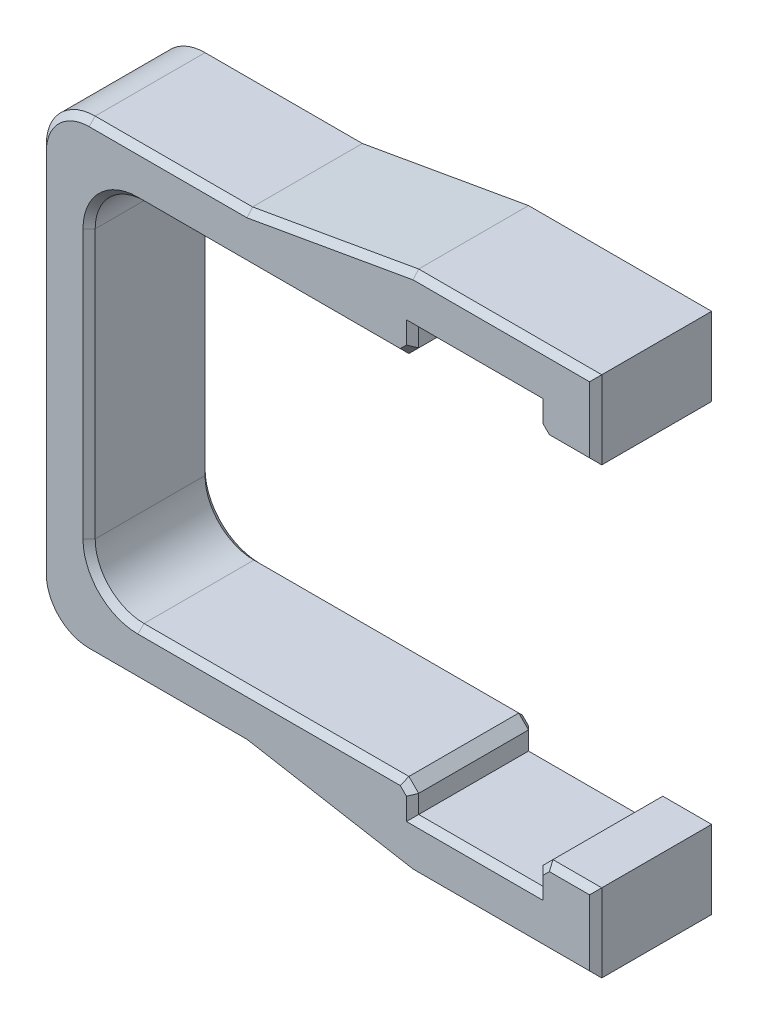
from build123d import *
from OCP.BRepFilletAPI import BRepFilletAPI_MakeChamfer

# Parameters (mm, degrees)
BOSS_EXTRUDE1_DEPTH = 10
FILLET1_R           = 4
SKETCH3_W           = 10
SKETCH3_H           = 6.4
BOSS_EXTRUDE2_DEPTH = 15
SKETCH5_W           = 10.2
SKETCH5_H           = 34.6
CUT_EXTRUDE1_DEPTH  = 15
CHAMFER2_SIZE       = 13.611076367
CHAMFER2_SIZE_2     = 2.4
CHAMFER3_SIZE       = 0.8
CHAMFER1_SIZE       = 0.5


# Some blends are built 0.0001 mm under size
with BuildPart() as part:
    # Sketch1 → Boss-Extrude1 (new body)
    with BuildSketch(Plane.XY):
        Polygon((0, 0), (0, 38), (30.5, 38), (30.5, 34), (4, 34), (4, 4), (30.5, 4), (30.5, 0), align=None)
    extrude(amount=BOSS_EXTRUDE1_DEPTH)

    # Fillet1
    fillet1_edges = [part.edges().sort_by_distance(p)[0] for p in [
        (0, 0, 5),
        (0, 38, 5),
        (4, 34, 5),
        (4, 4, 5),
    ]]
    fillet(fillet1_edges, radius=FILLET1_R)

    # Sketch3 → Boss-Extrude2 (add)
    with BuildSketch(Plane(origin=(30.5, 0, 0), x_dir=(0, 0, -1), z_dir=(1, 0, 0))):
        with Locations((-5, 37.2)):
            Rectangle(SKETCH3_W, SKETCH3_H)
        with Locations((-5, 0.8)):
            Rectangle(SKETCH3_W, SKETCH3_H)
    extrude(amount=BOSS_EXTRUDE2_DEPTH)

    # Sketch5 → Cut-Extrude1 (cut)
    with BuildSketch(Plane.XY.offset(10)):
        with Locations((35.6, 19)):
            Rectangle(SKETCH5_W, SKETCH5_H)
    extrude(amount=-CUT_EXTRUDE1_DEPTH, mode=Mode.SUBTRACT)

    # Chamfer2
    chamfer2_edges_1 = [part.edges().sort_by_distance(p)[0] for p in [
        (30.5, 0, 5),
    ]]
    chamfer2_side_1 = [part.faces().sort_by_distance(p)[0] for p in [
        (30.452, 0, 5),
    ]]
    chamfer2_edges_2 = [part.edges().sort_by_distance(p)[0] for p in [
        (30.5, 38, 5),
    ]]
    chamfer2_side_2 = [part.faces().sort_by_distance(p)[0] for p in [
        (30.5, 38.048, 5),
    ]]
    chamfer2 = BRepFilletAPI_MakeChamfer(part.part.solid().wrapped)
    for e in chamfer2_edges_1:
        chamfer2.Add(CHAMFER2_SIZE - 0.0001, CHAMFER2_SIZE_2 - 0.0001, e.wrapped, chamfer2_side_1[0].wrapped)
    for e in chamfer2_edges_2:
        chamfer2.Add(CHAMFER2_SIZE_2 - 0.0001, CHAMFER2_SIZE - 0.0001, e.wrapped, chamfer2_side_2[0].wrapped)
    add(Compound.cast(chamfer2.Shape()), mode=Mode.REPLACE)  # a hair under: the kernel refuses the full size

    # Chamfer3
    chamfer3_edges = [part.edges().sort_by_distance(p)[0] for p in [
        (30.5, 4, 5),
        (30.5, 34, 5),
        (40.7, 34, 5),
        (40.7, 4, 5),
    ]]
    chamfer(chamfer3_edges, length=CHAMFER3_SIZE)

    # Chamfer1
    # the kernel refuses this chamfer: 0.5 mm, written as the material it takes off along each edge
    with BuildSketch(Plane(origin=(46.785841494, 4, 10), x_dir=(0, 0, -1), z_dir=(-1, 0, 0)), Plane(origin=(40.214158506, 34, 10), x_dir=(0, 0, -1), z_dir=(1, 0, 0))) as chamfer1_piece_1:
        Polygon((CHAMFER1_SIZE, 0), (0, CHAMFER1_SIZE), (0, 0), align=None)
    extrude(amount=6.571682988, mode=Mode.SUBTRACT)
    with BuildSketch(Plane(origin=(4, 38, 0), x_dir=(0, -1, 0), z_dir=(1, 0, 0))) as chamfer1_piece_2_section:
        Polygon((CHAMFER1_SIZE, 0), (0, -CHAMFER1_SIZE), (0, 0), align=None)
    chamfer1_piece_2 = extrude(amount=14.174865127, mode=Mode.PRIVATE)
    chamfer1_piece_2 = split(chamfer1_piece_2, bisect_by=Plane(origin=(4.237723472, 36.651756922, 1.369040484), z_dir=(-0.1227837169605106, 0.6963649609575091, -0.7071067811865536)), keep=Keep.TOP, mode=Mode.PRIVATE)
    add(chamfer1_piece_2, mode=Mode.SUBTRACT)
    with BuildSketch(Plane(origin=(4, 38, 10), x_dir=(0, 0, -1), z_dir=(1, 0, 0))) as chamfer1_piece_3_section:
        Polygon((CHAMFER1_SIZE, 0), (0, -CHAMFER1_SIZE), (0, 0), align=None)
    chamfer1_piece_3 = extrude(amount=14.174865127, mode=Mode.PRIVATE)
    chamfer1_piece_3 = split(chamfer1_piece_3, bisect_by=Plane(origin=(4.237723472, 36.651756922, 8.630959516), z_dir=(-0.1227837169605106, 0.6963649609575091, 0.7071067811865536)), keep=Keep.TOP, mode=Mode.PRIVATE)
    add(chamfer1_piece_3, mode=Mode.SUBTRACT)
    with BuildSketch(Plane(origin=(15.62271565, 0.2232766, 0), x_dir=(0.17364239776413462, 0.9848087721475283, 0), z_dir=(0.9848087721475283, -0.17364239776413462, 0))) as chamfer1_piece_4_section:
        Polygon((CHAMFER1_SIZE, 0), (0, CHAMFER1_SIZE), (0, 0), align=None)
    chamfer1_piece_4 = extrude(amount=16.392616302, mode=Mode.PRIVATE)
    chamfer1_piece_4 = split(chamfer1_piece_4, bisect_by=Plane(origin=(15.62271565, 0.3616383, 0.1383617), z_dir=(0, -0.7071067811865471, -0.7071067811865479)), keep=Keep.TOP, mode=Mode.PRIVATE)
    add(chamfer1_piece_4, mode=Mode.SUBTRACT)
    with BuildSketch(Plane(origin=(15.62271565, 0.2232766, 10), x_dir=(0, 0, -1), z_dir=(0.9848087721475283, -0.17364239776413462, 0))) as chamfer1_piece_5_section:
        Polygon((CHAMFER1_SIZE, 0), (0, CHAMFER1_SIZE), (0, 0), align=None)
    chamfer1_piece_5 = extrude(amount=16.392616302, mode=Mode.PRIVATE)
    chamfer1_piece_5 = split(chamfer1_piece_5, bisect_by=Plane(origin=(15.62271565, 0.3616383, 9.8616383), z_dir=(0, -0.7071067811865471, 0.7071067811865479)), keep=Keep.TOP, mode=Mode.PRIVATE)
    add(chamfer1_piece_5, mode=Mode.SUBTRACT)
    with BuildSketch(Plane(origin=(31.766307983, 40.6231766, 0), x_dir=(0.17364239776413495, -0.9848087721475282, 0), z_dir=(-0.9848087721475282, -0.17364239776413493, 0))) as chamfer1_piece_6_section:
        Polygon((CHAMFER1_SIZE, 0), (0, CHAMFER1_SIZE), (0, 0), align=None)
    chamfer1_piece_6 = extrude(amount=16.392616302, mode=Mode.PRIVATE)
    chamfer1_piece_6 = split(chamfer1_piece_6, bisect_by=Plane(origin=(31.766307983, 39.0615883, 1.5615883), z_dir=(0, 0.7071067811865476, -0.7071067811865476)), keep=Keep.TOP, mode=Mode.PRIVATE)
    add(chamfer1_piece_6, mode=Mode.SUBTRACT)
    with BuildSketch(Plane(origin=(31.766307983, 40.6231766, 10), x_dir=(0, 0, -1), z_dir=(-0.9848087721475282, -0.17364239776413493, 0))) as chamfer1_piece_7_section:
        Polygon((CHAMFER1_SIZE, 0), (0, CHAMFER1_SIZE), (0, 0), align=None)
    chamfer1_piece_7 = extrude(amount=16.392616302, mode=Mode.PRIVATE)
    chamfer1_piece_7 = split(chamfer1_piece_7, bisect_by=Plane(origin=(31.766307983, 39.0615883, 8.4384117), z_dir=(0, 0.7071067811865476, 0.7071067811865476)), keep=Keep.TOP, mode=Mode.PRIVATE)
    add(chamfer1_piece_7, mode=Mode.SUBTRACT)
    with BuildSketch(Plane(origin=(40.7, 37.585841494, 10), x_dir=(0, 0, -1), z_dir=(0, -1, 0))) as chamfer1_piece_8_section:
        Polygon((CHAMFER1_SIZE, 0), (0, CHAMFER1_SIZE), (0, 0), align=None)
    chamfer1_piece_8 = extrude(amount=4.071682988, mode=Mode.PRIVATE)
    chamfer1_piece_8 = split(chamfer1_piece_8, bisect_by=Plane(origin=(40.7, 37.192920747, 10.392920747), z_dir=(0, -0.7071067811865476, 0.7071067811865476)), keep=Keep.TOP, mode=Mode.PRIVATE)
    add(chamfer1_piece_8, mode=Mode.SUBTRACT)
    with BuildSketch(Plane(origin=(30.5, 0.414158506, 10), x_dir=(0, 0, -1), z_dir=(0, 1, 0))) as chamfer1_piece_9_section:
        Polygon((CHAMFER1_SIZE, 0), (0, CHAMFER1_SIZE), (0, 0), align=None)
    chamfer1_piece_9 = extrude(amount=4.071682988, mode=Mode.PRIVATE)
    chamfer1_piece_9 = split(chamfer1_piece_9, bisect_by=Plane(origin=(30.5, 0.807079253, 10.392920747), z_dir=(0, 0.7071067811865476, 0.7071067811865476)), keep=Keep.TOP, mode=Mode.PRIVATE)
    add(chamfer1_piece_9, mode=Mode.SUBTRACT)
    with BuildSketch(Plane(origin=(30.985841494, 4, 10), x_dir=(0, 0, -1), z_dir=(-1, 0, 0)), Plane(origin=(8, 34, 10), x_dir=(0, 0, -1), z_dir=(1, 0, 0))) as chamfer1_piece_10:
        Polygon((CHAMFER1_SIZE, 0), (0, CHAMFER1_SIZE), (0, 0), align=None)
    extrude(amount=22.985841494, mode=Mode.SUBTRACT)
    with BuildSketch(Plane(origin=(31.40922724, 35.70922724, 10), x_dir=(0, 0, -1), z_dir=(-0.7071067811865491, -0.707106781186546, 0)), Plane(origin=(42.40922724, 33.09077276, 10), x_dir=(0, 0, -1), z_dir=(-0.7071067811865476, 0.7071067811865476, 0)), Plane(origin=(31.40922724, 35.70922724, 0), x_dir=(-0.7071067811865459, 0.707106781186549, 0), z_dir=(-0.7071067811865491, -0.707106781186546, 0)), Plane(origin=(42.40922724, 33.09077276, 0), x_dir=(0.7071067811865476, 0.7071067811865476, 1.7763568394002363e-15), z_dir=(-0.7071067811865476, 0.7071067811865476, 0))) as chamfer1_piece_11:
        Polygon((CHAMFER1_SIZE, 0), (0, -CHAMFER1_SIZE), (0, 0), align=None)
    extrude(amount=3.703053838, mode=Mode.SUBTRACT)
    with BuildSketch(Plane(origin=(31.40922724, 2.29077276, 10), x_dir=(0, 0, -1), z_dir=(-0.7071067811865479, 0.7071067811865471, 0)), Plane(origin=(42.40922724, 4.90922724, 10), x_dir=(0, 0, -1), z_dir=(-0.7071067811865464, -0.7071067811865487, 0)), Plane(origin=(31.40922724, 2.29077276, 0), x_dir=(-0.7071067811865472, -0.7071067811865479, 0), z_dir=(-0.7071067811865479, 0.7071067811865471, 0)), Plane(origin=(42.40922724, 4.90922724, 0), x_dir=(0.7071067811865486, -0.7071067811865464, 0), z_dir=(-0.7071067811865464, -0.7071067811865487, 0))) as chamfer1_piece_12:
        Polygon((CHAMFER1_SIZE, 0), (0, CHAMFER1_SIZE), (0, 0), align=None)
    extrude(amount=3.703053838, mode=Mode.SUBTRACT)
    with BuildSketch(Plane(origin=(40.7, 0.414158506, 0), x_dir=(1, 0, 0), z_dir=(0, 1, 0))) as chamfer1_piece_13_section:
        Polygon((CHAMFER1_SIZE, 0), (0, -CHAMFER1_SIZE), (0, 0), align=None)
    chamfer1_piece_13 = extrude(amount=4.071682988, mode=Mode.PRIVATE)
    chamfer1_piece_13 = split(chamfer1_piece_13, bisect_by=Plane(origin=(40.7, 0.807079253, -0.392920747), z_dir=(0, 0.7071067811865476, -0.7071067811865476)), keep=Keep.TOP, mode=Mode.PRIVATE)
    add(chamfer1_piece_13, mode=Mode.SUBTRACT)
    with BuildSketch(Plane(origin=(30.5, 37.585841494, 0), x_dir=(-1, 0, 0), z_dir=(0, -1, 0))) as chamfer1_piece_14_section:
        Polygon((CHAMFER1_SIZE, 0), (0, -CHAMFER1_SIZE), (0, 0), align=None)
    chamfer1_piece_14 = extrude(amount=4.071682988, mode=Mode.PRIVATE)
    chamfer1_piece_14 = split(chamfer1_piece_14, bisect_by=Plane(origin=(30.5, 37.192920747, -0.392920747), z_dir=(0, -0.7071067811865476, -0.7071067811865476)), keep=Keep.TOP, mode=Mode.PRIVATE)
    add(chamfer1_piece_14, mode=Mode.SUBTRACT)
    with BuildSketch(Plane(origin=(8, 4, 0), x_dir=(0, -1, 0), z_dir=(1, 0, 0)), Plane(origin=(30.985841494, 34, 0), x_dir=(0, 1, 0), z_dir=(-1, 0, 0))) as chamfer1_piece_15:
        Polygon((CHAMFER1_SIZE, 0), (0, -CHAMFER1_SIZE), (0, 0), align=None)
    extrude(amount=22.985841494, mode=Mode.SUBTRACT)
    with BuildSketch(Plane(origin=(46.785841494, 34, 0), x_dir=(0, 1, 0), z_dir=(-1, 0, 0)), Plane(origin=(40.214158506, 4, 0), x_dir=(0, -1, 0), z_dir=(1, 0, 0))) as chamfer1_piece_16:
        Polygon((CHAMFER1_SIZE, 0), (0, -CHAMFER1_SIZE), (0, 0), align=None)
    extrude(amount=6.571682988, mode=Mode.SUBTRACT)
    with BuildSketch(Plane(origin=(4, 30, 0), x_dir=(-1, 0, 0), z_dir=(0, -1, 0)), Plane(origin=(4, 30, 10), x_dir=(0, 0, -1), z_dir=(0, -1, 0))) as chamfer1_piece_17:
        Polygon((CHAMFER1_SIZE, 0), (0, -CHAMFER1_SIZE), (0, 0), align=None)
    extrude(amount=22, mode=Mode.SUBTRACT)
    with BuildSketch(Plane(origin=(0, 4, 0), x_dir=(1, 0, 0), z_dir=(0, 1, 0)), Plane(origin=(0, 4, 10), x_dir=(0, 0, -1), z_dir=(0, 1, 0))) as chamfer1_piece_18:
        Polygon((CHAMFER1_SIZE, 0), (0, -CHAMFER1_SIZE), (0, 0), align=None)
    extrude(amount=30, mode=Mode.SUBTRACT)
    with BuildSketch(Plane(origin=(18.174865127, 0, 0), x_dir=(0, 1, 0), z_dir=(-1, 0, 0))) as chamfer1_piece_19_section:
        Polygon((CHAMFER1_SIZE, 0), (0, -CHAMFER1_SIZE), (0, 0), align=None)
    chamfer1_piece_19 = extrude(amount=14.174865127, mode=Mode.PRIVATE)
    chamfer1_piece_19 = split(chamfer1_piece_19, bisect_by=Plane(origin=(18.198890584, 0.136259816, 0.1383617), z_dir=(-0.12278371696051142, -0.6963649609575149, -0.7071067811865478)), keep=Keep.TOP, mode=Mode.PRIVATE)
    add(chamfer1_piece_19, mode=Mode.SUBTRACT)
    with BuildSketch(Plane(origin=(4, 4, 0), x_dir=(-1, 0, 0), z_dir=(0, 1, 0))) as chamfer1_piece_20:
        Polygon((4 - CHAMFER1_SIZE, 0), (4, CHAMFER1_SIZE), (4, 0), align=None)
    revolve(axis=Axis((4, 4, 0), (0, 0, 1)), revolution_arc=90, mode=Mode.SUBTRACT)
    with BuildSketch(Plane(origin=(4, 34, 0), x_dir=(-1, 0, 0), z_dir=(0, -1, 0))) as chamfer1_piece_21:
        Polygon((4 - CHAMFER1_SIZE, 0), (4, -CHAMFER1_SIZE), (4, 0), align=None)
    revolve(axis=Axis((4, 34, 0), (0, 0, -1)), revolution_arc=90, mode=Mode.SUBTRACT)
    with BuildSketch(Plane(origin=(18.174865127, 0, 10), x_dir=(0, 0, -1), z_dir=(-1, 0, 0))) as chamfer1_piece_22_section:
        Polygon((CHAMFER1_SIZE, 0), (0, -CHAMFER1_SIZE), (0, 0), align=None)
    chamfer1_piece_22 = extrude(amount=14.174865127, mode=Mode.PRIVATE)
    chamfer1_piece_22 = split(chamfer1_piece_22, bisect_by=Plane(origin=(18.198890584, 0.136259816, 9.8616383), z_dir=(-0.12278371696051138, -0.6963649609575147, 0.7071067811865477)), keep=Keep.TOP, mode=Mode.PRIVATE)
    add(chamfer1_piece_22, mode=Mode.SUBTRACT)
    with BuildSketch(Plane(origin=(4, 4, 10), x_dir=(-1, 0, 0), z_dir=(0, 1, 0))) as chamfer1_piece_23:
        Polygon((4, -CHAMFER1_SIZE), (4 - CHAMFER1_SIZE, 0), (4, 0), align=None)
    revolve(axis=Axis((4, 4, 10), (0, 0, 1)), revolution_arc=90, mode=Mode.SUBTRACT)
    with BuildSketch(Plane(origin=(4, 34, 10), x_dir=(-1, 0, 0), z_dir=(0, -1, 0))) as chamfer1_piece_24:
        Polygon((4, CHAMFER1_SIZE), (4 - CHAMFER1_SIZE, 0), (4, 0), align=None)
    revolve(axis=Axis((4, 34, 10), (0, 0, -1)), revolution_arc=90, mode=Mode.SUBTRACT)
    with BuildSketch(Plane(origin=(8, 8, 0), x_dir=(-1, 0, 0), z_dir=(0, 1, 0))) as chamfer1_piece_25:
        Polygon((4 + CHAMFER1_SIZE, 0), (4, CHAMFER1_SIZE), (4, 0), align=None)
    revolve(axis=Axis((8, 8, 0), (0, 0, 1)), revolution_arc=90, mode=Mode.SUBTRACT)
    with BuildSketch(Plane(origin=(8, 8, 10), x_dir=(-1, 0, 0), z_dir=(0, 1, 0))) as chamfer1_piece_26:
        Polygon((4, -CHAMFER1_SIZE), (4 + CHAMFER1_SIZE, 0), (4, 0), align=None)
    revolve(axis=Axis((8, 8, 10), (0, 0, 1)), revolution_arc=90, mode=Mode.SUBTRACT)
    with BuildSketch(Plane(origin=(8, 30, 0), x_dir=(0, 1, 0), z_dir=(1, 0, 0))) as chamfer1_piece_27:
        Polygon((4 + CHAMFER1_SIZE, 0), (4, CHAMFER1_SIZE), (4, 0), align=None)
    revolve(axis=Axis((8, 30, 0), (0, 0, 1)), revolution_arc=90, mode=Mode.SUBTRACT)
    with BuildSketch(Plane(origin=(8, 30, 10), x_dir=(0, 1, 0), z_dir=(1, 0, 0))) as chamfer1_piece_28:
        Polygon((4, -CHAMFER1_SIZE), (4 + CHAMFER1_SIZE, 0), (4, 0), align=None)
    revolve(axis=Axis((8, 30, 10), (0, 0, 1)), revolution_arc=90, mode=Mode.SUBTRACT)
    with BuildSketch(Plane(origin=(29.214158506, 40.4, 10), x_dir=(0, 0, -1), z_dir=(1, 0, 0)), Plane(origin=(29.214158506, 40.4, 0), x_dir=(0, -1, 0), z_dir=(1, 0, 0))) as chamfer1_piece_29:
        Polygon((CHAMFER1_SIZE, 0), (0, -CHAMFER1_SIZE), (0, 0), align=None)
    extrude(amount=17.571682988, mode=Mode.SUBTRACT)
    with BuildSketch(Plane(origin=(45.5, 41.685841494, 10), x_dir=(0, 0, -1), z_dir=(0, -1, 0)), Plane(origin=(45.5, 5.285841494, 10), x_dir=(0, 0, -1), z_dir=(0, -1, 0))) as chamfer1_piece_30:
        Polygon((CHAMFER1_SIZE, 0), (0, -CHAMFER1_SIZE), (0, 0), align=None)
    extrude(amount=8.971682988, mode=Mode.SUBTRACT)
    with BuildSketch(Plane(origin=(45.5, 32.714158506, 0), x_dir=(-1, 0, 0), z_dir=(0, 1, 0)), Plane(origin=(45.5, -3.685841494, 0), x_dir=(-1, 0, 0), z_dir=(0, 1, 0))) as chamfer1_piece_31:
        Polygon((CHAMFER1_SIZE, 0), (0, CHAMFER1_SIZE), (0, 0), align=None)
    extrude(amount=8.971682988, mode=Mode.SUBTRACT)
    with BuildSketch(Plane(origin=(29.214158506, -2.4, 0), x_dir=(0, 1, 0), z_dir=(1, 0, 0)), Plane(origin=(29.214158506, -2.4, 10), x_dir=(0, 0, -1), z_dir=(1, 0, 0))) as chamfer1_piece_32:
        Polygon((CHAMFER1_SIZE, 0), (0, CHAMFER1_SIZE), (0, 0), align=None)
    extrude(amount=17.571682988, mode=Mode.SUBTRACT)
    with BuildSketch(Plane(origin=(29.214158506, 1.7, 0), x_dir=(0, -1, 0), z_dir=(1, 0, 0))) as chamfer1_piece_33_section:
        Polygon((CHAMFER1_SIZE, 0), (0, -CHAMFER1_SIZE), (0, 0), align=None)
    chamfer1_piece_33 = extrude(amount=12.771682988, mode=Mode.PRIVATE)
    chamfer1_piece_33 = split(chamfer1_piece_33, bisect_by=Plane(origin=(35.207079253, 1.7, 5.992920747), z_dir=(-0.7071067811865476, 0, -0.7071067811865476)), keep=Keep.TOP, mode=Mode.PRIVATE)
    chamfer1_piece_33 = split(chamfer1_piece_33, bisect_by=Plane(origin=(29.607079253, 1.7, -0.392920747), z_dir=(0.7071067811865476, 0, -0.7071067811865476)), keep=Keep.TOP, mode=Mode.PRIVATE)
    add(chamfer1_piece_33, mode=Mode.SUBTRACT)
    with BuildSketch(Plane(origin=(30.5, 4.485841494, 0), x_dir=(-1, 0, 0), z_dir=(0, -1, 0))) as chamfer1_piece_34_section:
        Polygon((CHAMFER1_SIZE, 0), (0, -CHAMFER1_SIZE), (0, 0), align=None)
    chamfer1_piece_34 = extrude(amount=4.071682988, mode=Mode.PRIVATE)
    chamfer1_piece_34 = split(chamfer1_piece_34, bisect_by=Plane(origin=(30.5, 2.842920747, 1.642920747), z_dir=(0, 0.7071067811865476, -0.7071067811865476)), keep=Keep.TOP, mode=Mode.PRIVATE)
    add(chamfer1_piece_34, mode=Mode.SUBTRACT)
    with BuildSketch(Plane(origin=(40.7, 33.514158506, 0), x_dir=(1, 0, 0), z_dir=(0, 1, 0))) as chamfer1_piece_35_section:
        Polygon((CHAMFER1_SIZE, 0), (0, -CHAMFER1_SIZE), (0, 0), align=None)
    chamfer1_piece_35 = extrude(amount=4.071682988, mode=Mode.PRIVATE)
    chamfer1_piece_35 = split(chamfer1_piece_35, bisect_by=Plane(origin=(40.7, 35.157079253, 1.642920747), z_dir=(0, -0.7071067811865476, -0.7071067811865476)), keep=Keep.TOP, mode=Mode.PRIVATE)
    add(chamfer1_piece_35, mode=Mode.SUBTRACT)
    with BuildSketch(Plane(origin=(41.985841494, 36.3, 0), x_dir=(0, 1, 0), z_dir=(-1, 0, 0))) as chamfer1_piece_36_section:
        Polygon((CHAMFER1_SIZE, 0), (0, -CHAMFER1_SIZE), (0, 0), align=None)
    chamfer1_piece_36 = extrude(amount=12.771682988, mode=Mode.PRIVATE)
    chamfer1_piece_36 = split(chamfer1_piece_36, bisect_by=Plane(origin=(41.592920747, 36.3, -0.392920747), z_dir=(-0.7071067811865476, 0, -0.7071067811865476)), keep=Keep.TOP, mode=Mode.PRIVATE)
    chamfer1_piece_36 = split(chamfer1_piece_36, bisect_by=Plane(origin=(35.992920747, 36.3, 5.992920747), z_dir=(0.7071067811865476, 0, -0.7071067811865476)), keep=Keep.TOP, mode=Mode.PRIVATE)
    add(chamfer1_piece_36, mode=Mode.SUBTRACT)
    with BuildSketch(Plane(origin=(40.7, 4.485841494, 10), x_dir=(0, 0, -1), z_dir=(0, -1, 0))) as chamfer1_piece_37_section:
        Polygon((CHAMFER1_SIZE, 0), (0, CHAMFER1_SIZE), (0, 0), align=None)
    chamfer1_piece_37 = extrude(amount=4.071682988, mode=Mode.PRIVATE)
    chamfer1_piece_37 = split(chamfer1_piece_37, bisect_by=Plane(origin=(40.7, 2.842920747, 8.357079253), z_dir=(0, 0.7071067811865476, 0.7071067811865476)), keep=Keep.TOP, mode=Mode.PRIVATE)
    add(chamfer1_piece_37, mode=Mode.SUBTRACT)
    with BuildSketch(Plane(origin=(41.985841494, 1.7, 10), x_dir=(0, 0, -1), z_dir=(-1, 0, 0))) as chamfer1_piece_38_section:
        Polygon((CHAMFER1_SIZE, 0), (0, CHAMFER1_SIZE), (0, 0), align=None)
    chamfer1_piece_38 = extrude(amount=12.771682988, mode=Mode.PRIVATE)
    chamfer1_piece_38 = split(chamfer1_piece_38, bisect_by=Plane(origin=(35.992920747, 1.7, 4.007079253), z_dir=(0.7071067811865476, 0, 0.7071067811865476)), keep=Keep.TOP, mode=Mode.PRIVATE)
    chamfer1_piece_38 = split(chamfer1_piece_38, bisect_by=Plane(origin=(41.592920747, 1.7, 10.392920747), z_dir=(-0.7071067811865476, 0, 0.7071067811865476)), keep=Keep.TOP, mode=Mode.PRIVATE)
    add(chamfer1_piece_38, mode=Mode.SUBTRACT)
    with BuildSketch(Plane(origin=(30.5, 33.514158506, 10), x_dir=(0, 0, -1), z_dir=(0, 1, 0))) as chamfer1_piece_39_section:
        Polygon((CHAMFER1_SIZE, 0), (0, CHAMFER1_SIZE), (0, 0), align=None)
    chamfer1_piece_39 = extrude(amount=4.071682988, mode=Mode.PRIVATE)
    chamfer1_piece_39 = split(chamfer1_piece_39, bisect_by=Plane(origin=(30.5, 35.157079253, 8.357079253), z_dir=(0, -0.7071067811865476, 0.7071067811865476)), keep=Keep.TOP, mode=Mode.PRIVATE)
    add(chamfer1_piece_39, mode=Mode.SUBTRACT)
    with BuildSketch(Plane(origin=(29.214158506, 36.3, 10), x_dir=(0, 0, -1), z_dir=(1, 0, 0))) as chamfer1_piece_40_section:
        Polygon((CHAMFER1_SIZE, 0), (0, CHAMFER1_SIZE), (0, 0), align=None)
    chamfer1_piece_40 = extrude(amount=12.771682988, mode=Mode.PRIVATE)
    chamfer1_piece_40 = split(chamfer1_piece_40, bisect_by=Plane(origin=(35.207079253, 36.3, 4.007079253), z_dir=(-0.7071067811865476, 0, 0.7071067811865476)), keep=Keep.TOP, mode=Mode.PRIVATE)
    chamfer1_piece_40 = split(chamfer1_piece_40, bisect_by=Plane(origin=(29.607079253, 36.3, 10.392920747), z_dir=(0.7071067811865476, 0, 0.7071067811865476)), keep=Keep.TOP, mode=Mode.PRIVATE)
    add(chamfer1_piece_40, mode=Mode.SUBTRACT)


solid = part.part
